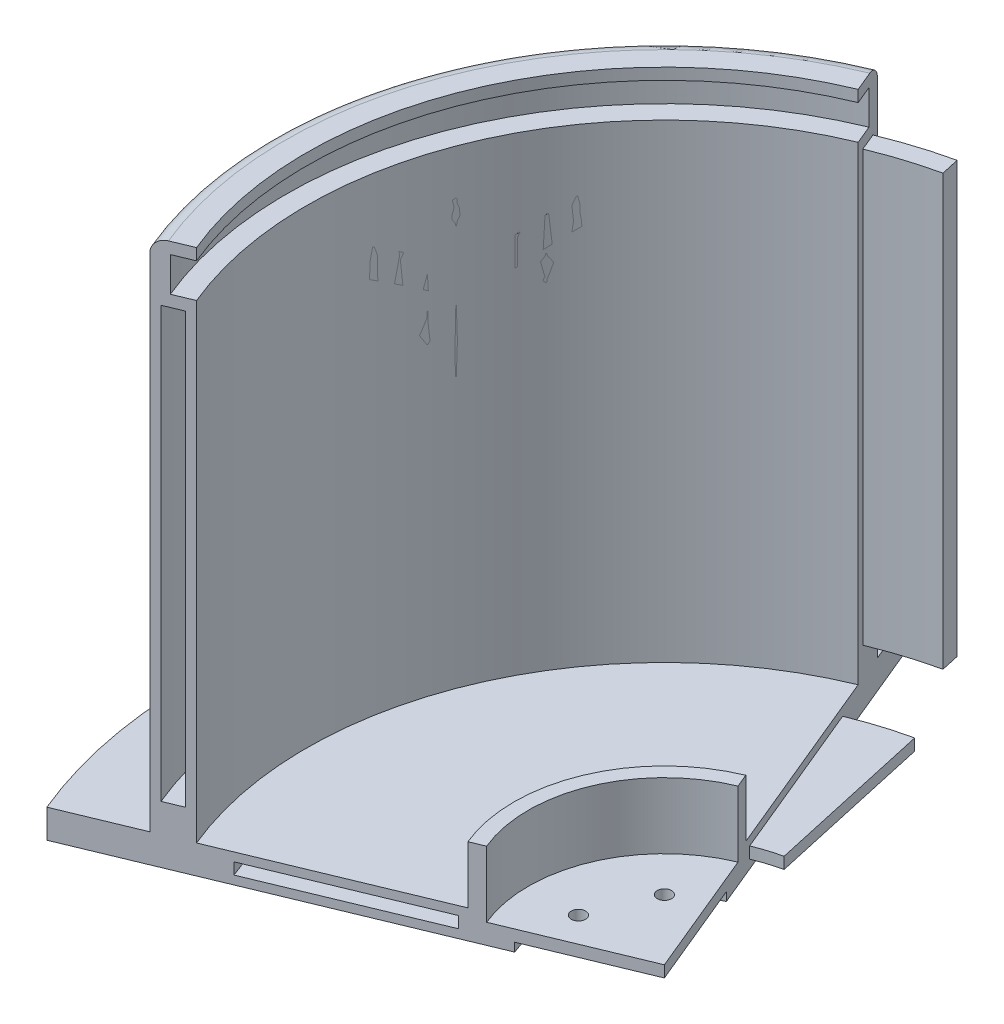
from build123d import *
from OCP.BRepAlgoAPI import BRepAlgoAPI_Cut
from OCP.TopTools import TopTools_ListOfShape

# Parameters (mm, degrees)
SKETCH1_R                 = 137.5
SKETCH1_R_2               = 125
BOSS_EXTRUDE1_DEPTH       = 180
SKETCH2_R                 = 165
SKETCH2_R_2               = 2.5
BOSS_EXTRUDE2_DEPTH       = 10
SKETCH3_R                 = 52.5
SKETCH3_R_2               = 47.5
BOSS_EXTRUDE3_DEPTH       = 20
SKETCH4_W                 = 56
SKETCH4_H                 = 96
CUT_EXTRUDE4_DEPTH        = 150
SKETCH5_W                 = 56
SKETCH5_H                 = 10
BOSS_EXTRUDE4_DEPTH       = 56
SKETCH6_W                 = 56
SKETCH6_H                 = 56
BOSS_EXTRUDE5_DEPTH       = 10
SKETCH7_R                 = 2.5
SKETCH7_R_2               = 12.5
CUT_EXTRUDE5_DEPTH        = 10
SKETCH8_W                 = 56
SKETCH8_H                 = 86
BOSS_EXTRUDE6_DEPTH       = 5
FILLET1_R                 = 10
FILLET2_R                 = 5
SKETCH9_W                 = 31.730677801
SKETCH9_H                 = 6
CUT_EXTRUDE6_DEPTH        = 10
FILLET3_R                 = 5
CUT_EXTRUDE7_START        = -3
SKETCH10_R                = 47.5
CUT_EXTRUDE7_DEPTH        = 3
SKETCH11_R                = 5
CUT_EXTRUDE8_DEPTH        = 5
SKETCH13_W                = 14
SKETCH13_H                = 12
CUT_EXTRUDE9_DEPTH        = 301.915270467
SKETCH15_W                = 6.5
SKETCH15_H                = 150
SKETCH15_W_2              = 60
SKETCH15_H_2              = 4
REVOLVE1_ANGLE            = 10
SKETCH16_W                = 6.5
SKETCH16_H                = 150
SKETCH16_W_2              = 60
SKETCH16_H_2              = 4
CUT_REVOLVE2_ANGLE        = 10
SKETCH17_R                = 40
CUT_EXTRUDE10_DEPTH       = 3
SKETCH19_W                = 6.25044146
SKETCH19_H                = 4.086827108
BOSS_EXTRUDE7_DEPTH       = 55
BOSS_EXTRUDE32_START      = -55
BOSS_EXTRUDE32_DEPTH      = 55
BOSS_EXTRUDE35_START      = -52
BOSS_EXTRUDE35_DEPTH      = 52
BOSS_EXTRUDE36_START      = -50
BOSS_EXTRUDE36_DEPTH      = 50
BOSS_EXTRUDE36_2_DEPTH    = 50
BOSS_EXTRUDE36_3_DEPTH    = 50
BOSS_EXTRUDE36_4_DEPTH    = 50
BOSS_EXTRUDE36_5_DEPTH    = 50
BOSS_EXTRUDE36_6_DEPTH    = 50
CUT_EXTRUDE12_START       = -180
SKETCH20_R                = 125
SKETCH20_R_2              = 52.5
CUT_EXTRUDE12_DEPTH       = 180
CUT_EXTRUDE13_START       = -40.721630556
CUT_EXTRUDE13_OUTLINE_R   = 52.5
CUT_EXTRUDE13_DEPTH       = 11.721630556
CUT_EXTRUDE13_START_2     = -59
CUT_EXTRUDE13_2_OUTLINE_R = 52.5
CUT_EXTRUDE13_2_DEPTH     = 22
CUT_EXTRUDE13_START_3     = -58
CUT_EXTRUDE13_3_OUTLINE_R = 52.5
CUT_EXTRUDE13_3_DEPTH     = 22
CUT_EXTRUDE14_START       = -113
SKETCH20_4_R              = 125
SKETCH20_4_R_2            = 52.5
CUT_EXTRUDE14_DEPTH       = 113


with BuildPart() as part:
    # Sketch1 → Boss-Extrude1 (new body)
    with BuildSketch(Plane(origin=(0, 0, 0), x_dir=(1, 0, 0), z_dir=(0, 1, 0))):
        with Locations(Location((0, 0, 0), (0, 0, 90))):
            Circle(SKETCH1_R)
        with Locations(Location((0, 0, 0), (0, 0, 90))):
            Circle(SKETCH1_R_2, mode=Mode.SUBTRACT)
    extrude(amount=BOSS_EXTRUDE1_DEPTH)

    # Sketch2 → Boss-Extrude2 (add)
    with BuildSketch(Plane.XZ):
        with Locations(Location((0, 0, 0), (0, 0, 270))):
            Circle(SKETCH2_R)
        with Locations(Location((0, 150, 0), (0, 0, 270))):
            Circle(SKETCH2_R_2, mode=Mode.SUBTRACT)
        with Locations(Location((0, 30, 0), (0, 0, 270))):
            Circle(SKETCH2_R_2, mode=Mode.SUBTRACT)
        with Locations(Location((106.066017178, 106.066017178, 0), (0, 0, 270))):
            Circle(SKETCH2_R_2, mode=Mode.SUBTRACT)
        with Locations(Location((150, 0, 0), (0, 0, 270))):
            Circle(SKETCH2_R_2, mode=Mode.SUBTRACT)
        with Locations(Location((106.066017178, -106.066017178, 0), (0, 0, 270))):
            Circle(SKETCH2_R_2, mode=Mode.SUBTRACT)
        with Locations(Location((0, -150, 0), (0, 0, 270))):
            Circle(SKETCH2_R_2, mode=Mode.SUBTRACT)
        with Locations(Location((-106.066017178, -106.066017178, 0), (0, 0, 270))):
            Circle(SKETCH2_R_2, mode=Mode.SUBTRACT)
        with Locations(Location((-150, 0, 0), (0, 0, 270))):
            Circle(SKETCH2_R_2, mode=Mode.SUBTRACT)
        with Locations(Location((-106.066017178, 106.066017178, 0), (0, 0, 270))):
            Circle(SKETCH2_R_2, mode=Mode.SUBTRACT)
        with Locations(Location((21.213203436, 21.213203436, 0), (0, 0, 270))):
            Circle(SKETCH2_R_2, mode=Mode.SUBTRACT)
        with Locations(Location((30, 0, 0), (0, 0, 270))):
            Circle(SKETCH2_R_2, mode=Mode.SUBTRACT)
        with Locations(Location((21.213203436, -21.213203436, 0), (0, 0, 270))):
            Circle(SKETCH2_R_2, mode=Mode.SUBTRACT)
        with Locations(Location((0, -30, 0), (0, 0, 270))):
            Circle(SKETCH2_R_2, mode=Mode.SUBTRACT)
        with Locations(Location((-21.213203436, -21.213203436, 0), (0, 0, 270))):
            Circle(SKETCH2_R_2, mode=Mode.SUBTRACT)
        with Locations(Location((-30, 0, 0), (0, 0, 270))):
            Circle(SKETCH2_R_2, mode=Mode.SUBTRACT)
        with Locations(Location((-21.213203436, 21.213203436, 0), (0, 0, 270))):
            Circle(SKETCH2_R_2, mode=Mode.SUBTRACT)
    extrude(amount=BOSS_EXTRUDE2_DEPTH)

    # Sketch3 → Boss-Extrude3 (add)
    with BuildSketch(Plane(origin=(0, 0, 0), x_dir=(1, 0, 0), z_dir=(0, 1, 0))):
        with Locations(Location((0, 0, 0), (0, 0, 90))):
            Circle(SKETCH3_R)
        with Locations(Location((0, 0, 0), (0, 0, 270))):
            Circle(SKETCH3_R_2, mode=Mode.SUBTRACT)
    extrude(amount=BOSS_EXTRUDE3_DEPTH)

    # Sketch4 → Cut-Extrude4 (cut)
    with BuildSketch(Plane(origin=(0, 0, 0), x_dir=(0, 0, -1), z_dir=(1, 0, 0))):
        with Locations((0, 112)):
            Rectangle(SKETCH4_W, SKETCH4_H)
    extrude(amount=CUT_EXTRUDE4_DEPTH, mode=Mode.SUBTRACT)

    # Sketch5 → Boss-Extrude4 (add)
    with BuildSketch(Plane(origin=(0, 0, 28), x_dir=(-1, 0, 0), z_dir=(0, 0, -1))):
        with Locations((-121.823643025, 135)):
            Rectangle(SKETCH5_W, SKETCH5_H)
    extrude(amount=BOSS_EXTRUDE4_DEPTH)

    # Sketch6 → Boss-Extrude5 (add)
    with BuildSketch(Plane(origin=(0, 64, 0), x_dir=(1, 0, 0), z_dir=(0, 1, 0))):
        with Locations((121.823643025, 0)):
            Rectangle(SKETCH6_W, SKETCH6_H)
    extrude(amount=-BOSS_EXTRUDE5_DEPTH)

    # Sketch7 → Cut-Extrude5 (cut)
    with BuildSketch(Plane(origin=(0, 140, 0), x_dir=(1, 0, 0), z_dir=(0, 1, 0))):
        with Locations(Location((98.273643025, 23.55, 0), (0, 0, 270))):
            Circle(SKETCH7_R)
        with Locations(Location((145.373643025, 23.55, 0), (0, 0, 270))):
            Circle(SKETCH7_R)
        with Locations(Location((98.273643025, -23.55, 0), (0, 0, 270))):
            Circle(SKETCH7_R)
        with Locations(Location((145.373643025, -23.55, 0), (0, 0, 270))):
            Circle(SKETCH7_R)
        with Locations(Location((121.823643025, 0, 0), (0, 0, 270))):
            Circle(SKETCH7_R_2)
    extrude(amount=-CUT_EXTRUDE5_DEPTH, mode=Mode.SUBTRACT)

    # Sketch8 → Boss-Extrude6 (add)
    with BuildSketch(Plane(origin=(149.823643025, 0, 0), x_dir=(0, 0, -1), z_dir=(1, 0, 0))):
        with Locations((0, 97)):
            Rectangle(SKETCH8_W, SKETCH8_H)
    extrude(amount=BOSS_EXTRUDE6_DEPTH)

    # Fillet1
    # the kernel refuses this fillet: 10 mm, written as the material it takes off along each edge
    with BuildSketch(Plane(origin=(154.823643025, 165, -28), x_dir=(0, 0, 1), z_dir=(0, -1, 0))) as fillet1_piece_1:
        with BuildLine():
            CenterArc((FILLET1_R, FILLET1_R), FILLET1_R, 180, 90)
            Line((0, FILLET1_R), (0, 0))
            Line((0, 0), (FILLET1_R, 0))
        make_face()
    extrude(amount=136, mode=Mode.SUBTRACT)
    with BuildSketch(Plane(origin=(154.823643025, 29, 28), x_dir=(-1, 0, 0), z_dir=(0, 1, 0))) as fillet1_piece_2:
        with BuildLine():
            CenterArc((FILLET1_R, -FILLET1_R), FILLET1_R, 90, 90)
            Line((0, -FILLET1_R), (0, 0))
            Line((0, 0), (FILLET1_R, 0))
        make_face()
    extrude(amount=136, mode=Mode.SUBTRACT)

    # Fillet2
    fillet2_edges = [part.edges().sort_by_distance(p)[0] for p in [
        (93.823643025, 59, 28),
        (93.823643025, 59, -28),
        (93.823643025, 135, -28),
        (93.823643025, 135, 28),
    ]]
    fillet(fillet2_edges, radius=FILLET2_R)

    # Sketch9 → Cut-Extrude6 (cut)
    with BuildSketch(Plane(origin=(0, 140, 0), x_dir=(1, 0, 0), z_dir=(0, 1, 0))):
        with Locations((93.823643026, 0)):
            Rectangle(SKETCH9_W, SKETCH9_H)
    extrude(amount=-CUT_EXTRUDE6_DEPTH, mode=Mode.SUBTRACT)

    # Fillet3
    fillet3_edges = [part.edges().sort_by_distance(p)[0] for p in [
        (0, 180, 137.5),
    ]]
    fillet(fillet3_edges, radius=FILLET3_R)

    # Sketch10 → Cut-Extrude7 (cut)
    with BuildSketch(Plane(origin=(0, 0, 0), x_dir=(1, 0, 0), z_dir=(0, 1, 0)).offset(CUT_EXTRUDE7_START)):
        with Locations(Location((0, 0, 0), (0, 0, 270))):
            Circle(SKETCH10_R)
    extrude(amount=CUT_EXTRUDE7_DEPTH, mode=Mode.SUBTRACT)

    # Sketch11 → Cut-Extrude8 (cut)
    with BuildSketch(Plane(origin=(0, 0, 0), x_dir=(1, 0, 0), z_dir=(0, 1, 0))):
        with Locations(Location((0, 150, 0), (0, 0, 270))):
            Circle(SKETCH11_R)
        with Locations(Location((106.066017178, 106.066017178, 0), (0, 0, 270))):
            Circle(SKETCH11_R)
        with Locations(Location((150, 0, 0), (0, 0, 270))):
            Circle(SKETCH11_R)
        with Locations(Location((106.066017178, -106.066017178, 0), (0, 0, 270))):
            Circle(SKETCH11_R)
        with Locations(Location((0, -150, 0), (0, 0, 270))):
            Circle(SKETCH11_R)
        with Locations(Location((-106.066017178, -106.066017178, 0), (0, 0, 270))):
            Circle(SKETCH11_R)
        with Locations(Location((-150, 0, 0), (0, 0, 270))):
            Circle(SKETCH11_R)
        with Locations(Location((-106.066017178, 106.066017178, 0), (0, 0, 270))):
            Circle(SKETCH11_R)
    extrude(amount=-CUT_EXTRUDE8_DEPTH, mode=Mode.SUBTRACT)

    # Sketch13 → Cut-Revolve1 (revolve, cut)
    with BuildSketch(Plane.XY, mode=Mode.PRIVATE) as cut_revolve1_sk:
        with Locations((-125, 170)):
            Rectangle(SKETCH13_W, SKETCH13_H)
    revolve(cut_revolve1_sk.sketch.rotate(Axis((0, 0, 0), (0, 1, 0)), 90), axis=Axis((0, 0, 0), (0, 1, 0)), mode=Mode.SUBTRACT)

    # Sketch14 → Cut-Extrude9 (cut, through all)
    with BuildSketch(Plane(origin=(0, 180, 0), x_dir=(1, 0, 0), z_dir=(0, 1, 0))):
        with BuildLine():
            Line((-47.835429046, 115.484941564), (0, 0))
            Line((0, 0), (115.484941564, 47.835429046))
            ThreePointArc((115.484941564, 47.835429046), (47.835429046, 115.484941564), (-47.835429046, 115.484941564))
        make_face()
        with BuildLine():
            ThreePointArc((-47.835429046, 115.484941564), (47.835429046, 115.484941564), (115.484941564, 47.835429046))
            Line((115.484941564, 47.835429046), (122.414038058, 50.705554788))
            ThreePointArc((122.414038058, 50.705554788), (50.705554788, 122.414038058), (-50.705554788, 122.414038058))
            Line((-50.705554788, 122.414038058), (-47.835429046, 115.484941564))
        make_face()
        with BuildLine():
            ThreePointArc((-50.705554788, 122.414038058), (50.705554788, 122.414038058), (122.414038058, 50.705554788))
            Line((122.414038058, 50.705554788), (152.440122864, 63.14276634))
            ThreePointArc((152.440122864, 63.14276634), (63.14276634, 152.440122864), (-63.14276634, 152.440122864))
            Line((-63.14276634, 152.440122864), (-50.705554788, 122.414038058))
        make_face()
        with BuildLine():
            Line((152.440122864, 63.14276634), (122.414038058, 50.705554788))
            ThreePointArc((122.414038058, 50.705554788), (129.954049653, 25.849467667), (132.5, 0))
            Line((132.5, 0), (165, 0))
            ThreePointArc((165, 0), (161.829571267, 32.189903133), (152.440122864, 63.14276634))
        make_face()
        with BuildLine():
            Line((115.484941564, 47.835429046), (0, 0))
            Line((0, 0), (125, 0))
            ThreePointArc((125, 0), (122.59816005, 24.386290252), (115.484941564, 47.835429046))
        make_face()
        with BuildLine():
            Line((122.414038058, 50.705554788), (115.484941564, 47.835429046))
            ThreePointArc((115.484941564, 47.835429046), (122.59816005, 24.386290252), (125, 0))
            Line((125, 0), (132.5, 0))
            ThreePointArc((132.5, 0), (129.954049653, 25.849467667), (122.414038058, 50.705554788))
        make_face()
        with BuildLine():
            ThreePointArc((132.5, 0), (110.16972363, -73.613055875), (50.705554788, -122.414038058))
            Line((50.705554788, -122.414038058), (63.14276634, -152.440122864))
            ThreePointArc((63.14276634, -152.440122864), (137.19248603, -91.669088448), (165, 0))
            Line((165, 0), (132.5, 0))
        make_face()
        with BuildLine():
            ThreePointArc((125, 0), (103.933701538, -69.446279127), (47.835429046, -115.484941564))
            Line((47.835429046, -115.484941564), (50.705554788, -122.414038058))
            ThreePointArc((50.705554788, -122.414038058), (110.16972363, -73.613055875), (132.5, 0))
            Line((132.5, 0), (125, 0))
        make_face()
        with BuildLine():
            Line((125, 0), (0, 0))
            Line((0, 0), (47.835429046, -115.484941564))
            ThreePointArc((47.835429046, -115.484941564), (103.933701538, -69.446279127), (125, 0))
        make_face()
        with BuildLine():
            ThreePointArc((50.705554788, -122.414038058), (-50.705554788, -122.414038058), (-122.414038058, -50.705554788))
            Line((-122.414038058, -50.705554788), (-152.440122864, -63.14276634))
            ThreePointArc((-152.440122864, -63.14276634), (-63.14276634, -152.440122864), (63.14276634, -152.440122864))
            Line((63.14276634, -152.440122864), (50.705554788, -122.414038058))
        make_face()
        with BuildLine():
            ThreePointArc((47.835429046, -115.484941564), (-47.835429046, -115.484941564), (-115.484941564, -47.835429046))
            Line((-115.484941564, -47.835429046), (-122.414038058, -50.705554788))
            ThreePointArc((-122.414038058, -50.705554788), (-50.705554788, -122.414038058), (50.705554788, -122.414038058))
            Line((50.705554788, -122.414038058), (47.835429046, -115.484941564))
        make_face()
        with BuildLine():
            Line((47.835429046, -115.484941564), (0, 0))
            Line((0, 0), (-115.484941564, -47.835429046))
            ThreePointArc((-115.484941564, -47.835429046), (-47.835429046, -115.484941564), (47.835429046, -115.484941564))
        make_face()
    extrude(amount=-CUT_EXTRUDE9_DEPTH, mode=Mode.SUBTRACT)

    # Sketch15 → Revolve1 (revolve)
    with BuildSketch(Plane(origin=(0, 0, 0), x_dir=(-0.38268343236509034, 0, -0.9238795325112865), z_dir=(0.9238795325112865, 0, -0.38268343236509034))):
        with Locations((131.25, 85)):
            Rectangle(SKETCH15_W, SKETCH15_H)
        with Locations((85, -5)):
            Rectangle(SKETCH15_W_2, SKETCH15_H_2)
    revolve(axis=Axis((0, 0, 0), (0, -1, 0)), revolution_arc=REVOLVE1_ANGLE)

    # Sketch16 → Cut-Revolve2 (revolve, cut)
    with BuildSketch(Plane(origin=(0, 0, 0), x_dir=(0.9238795325112864, 0, -0.3826834323650908), z_dir=(0.3826834323650908, 0, 0.9238795325112864))):
        with Locations((-131.25, 85)):
            Rectangle(SKETCH16_W, SKETCH16_H)
        with Locations((-85, -5)):
            Rectangle(SKETCH16_W_2, SKETCH16_H_2)
    revolve(axis=Axis((0, 0, 0), (0, -1, 0)), revolution_arc=CUT_REVOLVE2_ANGLE, mode=Mode.SUBTRACT)

    # Sketch17 → Cut-Extrude10 (cut)
    with BuildSketch(Plane.XZ.offset(10)):
        Circle(SKETCH17_R)
    extrude(amount=-CUT_EXTRUDE10_DEPTH, mode=Mode.SUBTRACT)

    # Sketch19 → Boss-Extrude7 (add)
    # profile 1 of 9: a face of its own
    with BuildSketch(Plane(origin=(-81.660185305, 0, -33.824756259), x_dir=(0.3826834323650891, 0, -0.9238795325112871), z_dir=(0.9238795325112872, 0, 0.38268343236508917))):
        Polygon((62.618709378, 50), (62.618709378, 52.884819135), (58.772283864, 52.884819135), (58.772283864, 64.664497271), (62.618709378, 64.664497271), (62.618709378, 60.577670163), (67.186339675, 60.577670163), (67.186339675, 67.549316406), (43.626983404, 67.549316406), (43.626983404, 60.577670163), (48.194613701, 60.577670163), (48.194613701, 64.664497271), (52.041039215, 64.664497271), (52.041039215, 52.884819135), (48.194613701, 52.884819135), (48.194613701, 50), align=None)
    # profile 2 of 9: a face of its own
    with BuildSketch(Plane(origin=(-81.660185305, 0, -33.824756259), x_dir=(0.3826834323650891, 0, -0.9238795325112871), z_dir=(0.9238795325112872, 0, 0.38268343236508917))):
        Polygon((35.501409506, 50), (35.501409506, 52.884819135), (32.135787182, 52.884819135), (32.135787182, 64.664497271), (35.501409506, 64.664497271), (35.501409506, 67.549316406), (12.182454829, 67.549316406), (12.182454829, 62.260481325), (17.230888316, 62.260481325), (17.230888316, 64.664497271), (25.404542533, 64.664497271), (25.404542533, 60.577670163), (18.913699478, 60.577670163), (18.913699478, 57.692851027), (25.404542533, 57.692851027), (25.404542533, 52.884819135), (17.230888316, 52.884819135), (17.230888316, 55.288835081), (12.182454829, 55.288835081), (12.182454829, 50), align=None)
    # profile 3 of 9: a face of its own
    with BuildSketch(Plane(origin=(-81.660185305, 0, -33.824756259), x_dir=(0.3826834323650891, 0, -0.9238795325112871), z_dir=(0.9238795325112872, 0, 0.38268343236508917))):
        Polygon((-22.14689288, 52.884819135), (-22.14689288, 50), (-9.165206772, 50), (-9.165206772, 52.884819135), (-12.549610471, 52.884819135), (-11.295014649, 56.010039865), (-4.424787828, 56.010039865), (-3.016184735, 52.884819135), (-6.520789231, 52.884819135), (-6.520789231, 50), (5.258888905, 50), (5.258888905, 52.884819135), (1.89326658, 52.884819135), (-3.264098879, 64.664497271), (0.210455418, 64.664497271), (0.210455418, 67.549316406), (-17.098459394, 67.549316406), (-17.098459394, 64.664497271), (-13.46614155, 64.664497271), (-19.02167215, 52.884819135), align=None)
        Polygon((-10.198182373, 58.654457406), (-8.004517823, 63.916998563), (-5.645577176, 58.654457406), align=None, mode=Mode.SUBTRACT)
    # profile 4 of 9: a face of its own
    with BuildSketch(Plane(origin=(-81.660185305, 0, -33.824756259), x_dir=(0.3826834323650891, 0, -0.9238795325112871), z_dir=(0.9238795325112872, 0, 0.38268343236508917))):
        Polygon((-28.83005721, 50), (-28.83005721, 52.884819135), (-32.195679535, 52.884819135), (-32.195679535, 64.664497271), (-28.83005721, 64.664497271), (-28.83005721, 67.549316406), (-42.033363539, 67.549316406), (-47.664019638, 57.396105309), (-53.227062788, 67.549316406), (-66.813509158, 67.549316406), (-66.813509158, 64.664497271), (-63.447886834, 64.664497271), (-63.447886834, 52.884819135), (-66.813509158, 52.884819135), (-66.813509158, 50), (-53.591421455, 50), (-53.591421455, 52.884819135), (-56.716642185, 52.884819135), (-56.716642185, 64.664497271), (-56.100613099, 64.664497271), (-48.065941054, 50), (-45.267516242, 50), (-37.138937324, 64.664497271), (-36.522908238, 64.664497271), (-36.522908238, 52.884819135), (-39.888530562, 52.884819135), (-39.888530562, 50), align=None)
    # profile 5 of 9: a face of its own
    with BuildSketch(Plane(origin=(-81.660185305, 0, -33.824756259), x_dir=(0.3826834323650891, 0, -0.9238795325112871), z_dir=(0.9238795325112872, 0, 0.38268343236508917))):
        with BuildLine():
            Line((40.020959485, 20.392210242), (40.020959485, 17.507391107))
            Line((40.020959485, 17.507391107), (48.066900354, 17.507391107))
            Line((48.066900354, 17.507391107), (54.144553168, 25.200242134))
            Line((54.144553168, 25.200242134), (57.089472702, 25.200242134))
            Line((57.089472702, 25.200242134), (57.089472702, 20.392210242))
            Line((57.089472702, 20.392210242), (53.723850377, 20.392210242))
            Line((53.723850377, 20.392210242), (53.723850377, 17.507391107))
            Line((53.723850377, 17.507391107), (67.42674127, 17.507391107))
            Line((67.42674127, 17.507391107), (67.42674127, 20.392210242))
            Line((67.42674127, 20.392210242), (63.820717351, 20.392210242))
            Line((63.820717351, 20.392210242), (63.820717351, 32.171888378))
            Line((63.820717351, 32.171888378), (67.42674127, 32.171888378))
            Line((67.42674127, 32.171888378), (67.42674127, 35.056707513))
            Line((67.42674127, 35.056707513), (51.575261126, 35.056707513))
            add(Edge.make_bspline(
                [(51.575261126, 35.056707513), (51.21451779, 35.053114865), (50.518562345, 35.046183834), (49.514378248, 34.972864272), (48.587963374, 34.860611777), (47.7407578, 34.695655001), (46.969410445, 34.487791419), (46.27689696, 34.230306192), (45.660097726, 33.926366688), (45.1255031, 33.571206345), (44.664310771, 33.184669301), (44.259151916, 32.790593824), (43.914496183, 32.384631732), (43.632124285, 31.964986196), (43.415643324, 31.528850084), (43.26231542, 31.08047818), (43.161914244, 30.619964027), (43.151448728, 30.308040098), (43.146180215, 30.151012473)],
                knots=[0, 0, 0, 0, 1.600467958, 3.087664496, 4.465243776, 5.739016891, 6.914364946, 8.006181148, 9.012487675, 9.958636093, 10.846428019, 11.679342585, 12.463994951, 13.205191978, 13.918307352, 14.617610162, 15.304082272, 16, 16, 16, 16], degree=3))
            add(Edge.make_bspline(
                [(43.146180215, 30.151012473), (43.14988159, 30.028098036), (43.157167761, 29.786140488), (43.212199502, 29.430230037), (43.296475876, 29.086720378), (43.423461434, 28.758025145), (43.581076354, 28.439686557), (43.778742208, 28.135504563), (44.007759256, 27.841701519), (44.273757906, 27.561932954), (44.574373391, 27.295944018), (44.911575266, 27.043125711), (45.28418812, 26.804128493), (45.689801752, 26.57444078), (46.132126702, 26.360446673), (46.609119, 26.159155879), (47.119550269, 25.965946402), (47.475301159, 25.854537638), (47.657466388, 25.797489846)],
                knots=[0, 0, 0, 0, 0.873585475, 1.719656409, 2.555264747, 3.383633297, 4.219715739, 5.076630301, 5.958163372, 6.865001544, 7.817242384, 8.808988941, 9.858471776, 10.962711996, 12.121344946, 13.349930203, 14.643009512, 16, 16, 16, 16], degree=3))
            Line((47.657466388, 25.797489846), (43.386581809, 20.392210242))
            Line((43.386581809, 20.392210242), (40.020959485, 20.392210242))
        make_face()
        with BuildLine():
            Line((57.089472702, 28.085061269), (54.730532055, 28.085061269))
            add(Edge.make_bspline(
                [(54.730532055, 28.085061269), (54.553936171, 28.085909615), (54.211800833, 28.087553193), (53.715954108, 28.117006939), (53.254386515, 28.150988753), (52.826658815, 28.20720391), (52.434897585, 28.283118837), (52.073696179, 28.367450427), (51.748643467, 28.472251406), (51.455479367, 28.591072353), (51.200535505, 28.731470104), (50.974438265, 28.88072576), (50.783969739, 29.051116371), (50.630075658, 29.239838041), (50.506041631, 29.44232229), (50.418177549, 29.662971044), (50.370787973, 29.901102374), (50.36245432, 30.064428301), (50.358228053, 30.147256198)],
                knots=[0, 0, 0, 0, 1.582812427, 3.066527101, 4.451694772, 5.731188275, 6.930949323, 8.028082308, 9.053941831, 9.989892088, 10.858830093, 11.658924531, 12.413974936, 13.139757846, 13.83467985, 14.535019726, 15.257060789, 16, 16, 16, 16], degree=3))
            add(Edge.make_bspline(
                [(50.358228053, 30.147256198), (50.36042809, 30.230217254), (50.364703351, 30.391432751), (50.417760839, 30.623060212), (50.491028294, 30.840960761), (50.601118607, 31.042183668), (50.74720179, 31.22353438), (50.921661825, 31.390041839), (51.126749918, 31.540134487), (51.360189537, 31.676702473), (51.623868713, 31.788018531), (51.906393421, 31.897371772), (52.216586973, 31.980935822), (52.548577698, 32.05312248), (52.905447499, 32.103074011), (53.283440067, 32.146469694), (53.686049067, 32.167470057), (53.961731132, 32.170389748), (54.103234144, 32.171888378)],
                knots=[0, 0, 0, 0, 0.837845841, 1.628158325, 2.393598007, 3.159142566, 3.934896225, 4.741497232, 5.5930293, 6.501488864, 7.471574116, 8.485997326, 9.565149973, 10.71831551, 11.92256371, 13.209941372, 14.567909388, 16, 16, 16, 16], degree=3))
            Line((54.103234144, 32.171888378), (57.089472702, 32.171888378))
            Line((57.089472702, 32.171888378), (57.089472702, 28.085061269))
        make_face(mode=Mode.SUBTRACT)
    # profile 6 of 9: a face of its own
    with BuildSketch(Plane(origin=(-81.660185305, 0, -33.824756259), x_dir=(0.3826834323650891, 0, -0.9238795325112871), z_dir=(0.9238795325112872, 0, 0.38268343236508917))):
        with Locations((27.808558479, 19.550804661)):
            Rectangle(SKETCH19_W, SKETCH19_H)
    # profile 7 of 9: a face of its own
    with BuildSketch(Plane(origin=(-81.660185305, 0, -33.824756259), x_dir=(0.3826834323650891, 0, -0.9238795325112871), z_dir=(0.9238795325112872, 0, 0.38268343236508917))):
        Polygon((14.153747905, 17.507391107), (14.153747905, 20.392210242), (10.788125581, 20.392210242), (10.788125581, 32.171888378), (14.153747905, 32.171888378), (14.153747905, 35.056707513), (-9.165206772, 35.056707513), (-9.165206772, 29.767872432), (-4.116773285, 29.767872432), (-4.116773285, 32.171888378), (4.056880932, 32.171888378), (4.056880932, 28.085061269), (-2.433962123, 28.085061269), (-2.433962123, 25.200242134), (4.056880932, 25.200242134), (4.056880932, 20.392210242), (-4.116773285, 20.392210242), (-4.116773285, 22.796226188), (-9.165206772, 22.796226188), (-9.165206772, 17.507391107), align=None)
    # profile 8 of 9: a face of its own
    with BuildSketch(Plane(origin=(-81.660185305, 0, -33.824756259), x_dir=(0.3826834323650891, 0, -0.9238795325112871), z_dir=(0.9238795325112872, 0, 0.38268343236508917))):
        with Locations((-23.06041894, 19.550804661)):
            Rectangle(SKETCH19_W, SKETCH19_H)
    # profile 9 of 9: a face of its own
    with BuildSketch(Plane(origin=(-81.660185305, 0, -33.824756259), x_dir=(0.3826834323650891, 0, -0.9238795325112871), z_dir=(0.9238795325112872, 0, 0.38268343236508917))):
        with BuildLine():
            Line((-36.474827919, 17.507391107), (-36.474827919, 20.392210242))
            Line((-36.474827919, 20.392210242), (-40.561655027, 20.392210242))
            Line((-40.561655027, 20.392210242), (-40.561655027, 32.171888378))
            Line((-40.561655027, 32.171888378), (-36.474827919, 32.171888378))
            Line((-36.474827919, 32.171888378), (-36.474827919, 35.056707513))
            Line((-36.474827919, 35.056707513), (-48.994492213, 35.056707513))
            add(Edge.make_bspline(
                [(-48.994492213, 35.056707513), (-49.316283673, 35.056257841), (-49.943627942, 35.055381188), (-50.860274338, 35.040730762), (-51.727919814, 35.012773542), (-52.548465026, 34.982911735), (-53.319345657, 34.929765919), (-54.043845237, 34.882140504), (-54.718387747, 34.811567343), (-55.554383494, 34.71598637), (-56.556221994, 34.539669494), (-57.728337601, 34.235558052), (-58.871605685, 33.826177369), (-59.800221789, 33.412044763), (-60.512880687, 33.026396029), (-61.028169316, 32.721668805), (-61.506585868, 32.378511019), (-61.968305857, 32.025263593), (-62.394470174, 31.640380916), (-62.797645311, 31.235708336), (-63.17026339, 30.805477569), (-63.516787958, 30.355009845), (-63.829101508, 29.886923611), (-64.099601994, 29.401720615), (-64.329398339, 28.904510049), (-64.519421814, 28.396628672), (-64.660569004, 27.874089892), (-64.767943609, 27.341224122), (-64.827495888, 26.792996631), (-64.837273547, 26.42366728), (-64.842216082, 26.236974011)],
                knots=[0, 0, 0, 0, 1.332696504, 2.598140772, 3.796552738, 4.927965653, 5.998313975, 6.996582906, 7.934637337, 8.80681236, 10.481191126, 12.142680594, 13.815613367, 15.505219703, 16.347420755, 17.170927932, 17.982329855, 18.784147397, 19.577384055, 20.358407803, 21.148672732, 21.932771828, 22.710846321, 23.476922527, 24.230970006, 24.977491157, 25.719731627, 26.470258298, 27.226726824, 28, 28, 28, 28], degree=3))
            add(Edge.make_bspline(
                [(-64.842216082, 26.236974011), (-64.838874835, 26.085408791), (-64.832207878, 25.782983167), (-64.792459896, 25.331833738), (-64.714101656, 24.887298941), (-64.61507811, 24.44727704), (-64.48066234, 24.014374244), (-64.32472621, 23.583571759), (-64.13155267, 23.16102588), (-63.843011949, 22.609936344), (-63.438794574, 21.957872604), (-62.881685949, 21.249141834), (-62.277456608, 20.611867843), (-61.607296811, 20.059222735), (-60.877323782, 19.575473234), (-60.083222963, 19.146462865), (-59.22243016, 18.768190232), (-58.310187111, 18.448249348), (-57.384137632, 18.187222785), (-56.483569868, 17.960166919), (-55.618784047, 17.797430516), (-54.912441291, 17.693613174), (-54.332482494, 17.640010038), (-53.849239455, 17.601832226), (-53.31068067, 17.572384935), (-52.717044383, 17.551109394), (-52.068439325, 17.532579518), (-51.364772531, 17.516575313), (-50.607195811, 17.510508086), (-50.083811898, 17.50845303), (-49.813360145, 17.507391107)],
                knots=[0, 0, 0, 0, 0.653562848, 1.304086475, 1.95018235, 2.598394733, 3.247326054, 3.903181291, 4.572451889, 5.248545877, 6.584700914, 7.873019034, 9.129176232, 10.363651628, 11.609360228, 12.899294715, 14.250426218, 15.659035459, 17.063490434, 18.39768105, 19.661828393, 20.855862999, 21.474138548, 22.172621017, 22.945798865, 23.799360362, 24.733673004, 25.743404147, 26.833933771, 28, 28, 28, 28], degree=3))
            Line((-49.813360145, 17.507391107), (-36.474827919, 17.507391107))
        make_face()
        with BuildLine():
            Line((-47.292899676, 20.392210242), (-48.953173189, 20.392210242))
            add(Edge.make_bspline(
                [(-48.953173189, 20.392210242), (-49.197360411, 20.393213043), (-49.673366018, 20.39516785), (-50.368445993, 20.423034635), (-51.024835052, 20.463139472), (-51.641143044, 20.519365539), (-52.219121952, 20.589295456), (-52.757701329, 20.679797035), (-53.258766044, 20.78242077), (-53.722068374, 20.909056965), (-54.156661706, 21.049412811), (-54.56552114, 21.22038173), (-54.952226466, 21.416881258), (-55.321628682, 21.63214666), (-55.663843691, 21.87877742), (-55.985668094, 22.146943471), (-56.286677187, 22.440060243), (-56.565239221, 22.759698814), (-56.817078766, 23.104264003), (-57.036662816, 23.474986723), (-57.22106723, 23.871470328), (-57.371312258, 24.294110654), (-57.487457265, 24.741720748), (-57.568140343, 25.214268943), (-57.624206545, 25.711003971), (-57.628150456, 26.051500149), (-57.630168244, 26.225705186)],
                knots=[0, 0, 0, 0, 1.471220557, 2.867919254, 4.190781564, 5.433215145, 6.596362996, 7.69773095, 8.723120877, 9.676605245, 10.59034093, 11.473026839, 12.343505838, 13.202631779, 14.046315256, 14.881864041, 15.724805107, 16.575040716, 17.43366964, 18.292795582, 19.166961063, 20.064196578, 20.99193373, 21.949468653, 22.950904847, 24, 24, 24, 24], degree=3))
            add(Edge.make_bspline(
                [(-57.630168244, 26.225705186), (-57.628205351, 26.39242094), (-57.624357613, 26.719223402), (-57.566741408, 27.199384635), (-57.489080489, 27.661694244), (-57.364528977, 28.103538568), (-57.216995604, 28.528277124), (-57.031919457, 28.933868609), (-56.80827732, 29.31630998), (-56.557320607, 29.681674632), (-56.276482502, 30.021732358), (-55.970255397, 30.336233842), (-55.638792625, 30.621543961), (-55.284470371, 30.881164647), (-54.90798518, 31.116527754), (-54.504064475, 31.317404072), (-54.079523788, 31.495919068), (-53.627020393, 31.640649697), (-53.149431746, 31.76859657), (-52.641587271, 31.87708754), (-52.103568468, 31.965886739), (-51.534809039, 32.040810086), (-50.933638963, 32.101740043), (-50.300813587, 32.140489692), (-49.63707564, 32.169022618), (-49.184843703, 32.170917608), (-48.953173189, 32.171888378)],
                knots=[0, 0, 0, 0, 1.00094045, 1.962080932, 2.902028123, 3.814481939, 4.716205769, 5.60149496, 6.48790204, 7.374723979, 8.261801118, 9.134212688, 10.008891528, 10.886057597, 11.771155007, 12.672753318, 13.593387695, 14.535409596, 15.524406578, 16.563106428, 17.653864101, 18.799676788, 20.009274465, 21.283261448, 22.608262337, 24, 24, 24, 24], degree=3))
            Line((-48.953173189, 32.171888378), (-47.292899676, 32.171888378))
            Line((-47.292899676, 32.171888378), (-47.292899676, 20.392210242))
        make_face(mode=Mode.SUBTRACT)
    extrude(amount=-BOSS_EXTRUDE7_DEPTH)

    # Boss-Extrude32: read off the stored shape, not the designer's step
    # Boss-Extrude32 outline → Boss-Extrude32 (add)
    with BuildSketch(Plane(origin=(-81.660185305, 0, -33.824756259), x_dir=(0.3826834323650891, 0, -0.9238795325112871), z_dir=(0.9238795325112872, 0, 0.38268343236508917)).offset(BOSS_EXTRUDE32_START)):
        with BuildLine():
            ThreePointArc((0, 157.631397208), (-37.565698604, 147.565698604), (-27.5, 110))
            ThreePointArc((-27.5, 110), (-4.116118026, 82.809789034), (26.267823447, 101.860500547))
            Line((26.267823447, 101.860500547), (26.056807624, 102.07151637))
            ThreePointArc((26.056807624, 102.07151637), (-5.13066435, 89.909712799), (-13.894240986, 122.217105123))
            Line((-13.894240986, 122.217105123), (-21.790333493, 126.775916257))
            ThreePointArc((-21.790333493, 126.775916257), (-25.869384718, 119.328715578), (-27.482097315, 110.992132649))
            ThreePointArc((-27.482097315, 110.992132649), (-28.86654623, 145.481232801), (5.324463257, 140.749467978))
            Line((5.324463257, 140.749467978), (11.600814445, 144.473381606))
            ThreePointArc((11.600814445, 144.473381606), (8.047862169, 150.581831278), (3.055555556, 155.58318129))
            ThreePointArc((3.055555556, 155.58318129), (30.930476766, 137.594117641), (10.583720804, 111.390546029))
            Line((10.583720804, 111.390546029), (10.583720804, 106.498585359))
            ThreePointArc((10.583720804, 106.498585359), (40.679189319, 139.389634614), (0, 157.631397208))
        make_face()
        with BuildLine():
            ThreePointArc((24.962733118, 120.379753679), (25.149339372, 120.537706968), (25.333720804, 120.698251736))
            ThreePointArc((25.333720804, 120.698251736), (23.613225928, 124.094877129), (21.440070063, 127.221306445))
            Line((21.440070063, 127.221306445), (20.268661801, 126.526281094))
            ThreePointArc((20.268661801, 126.526281094), (22.881771355, 123.65621665), (24.962733118, 120.379753679))
        make_face()
        with BuildLine():
            ThreePointArc((-11.254013242, 144.11567211), (-9.335086964, 147.201498152), (-6.944444444, 149.938180224))
            ThreePointArc((-6.944444444, 149.938180224), (-7.558706992, 150.18389615), (-8.181818182, 150.406218525))
            ThreePointArc((-8.181818182, 150.406218525), (-10.110952568, 147.487016849), (-11.653790424, 144.346483574))
            Line((-11.653790424, 144.346483574), (-11.254013242, 144.11567211))
        make_face()
        Polygon((-11.218374311, 132.41322491), (-11.218374311, 122.404243585), (-2.5, 127.320508076), (-2.5, 137.329489401), align=None)
        Polygon((11.583720804, 123.117446868), (11.583720804, 133.126428193), (2.5, 137.329489401), (2.5, 127.320508076), align=None)
        Polygon((0.365346493, 113.871055358), (9.083720804, 118.787319849), (0, 122.990381057), (-8.718374311, 118.074116566), align=None)
    extrude(amount=BOSS_EXTRUDE32_DEPTH)

    # Sketch21<9> → Boss-Extrude35 (add)
    with BuildSketch(Plane(origin=(-81.660185305, 0, -33.824756259), x_dir=(0.3826834323650891, 0, -0.9238795325112871), z_dir=(0.9238795325112872, 0, 0.38268343236508917)).offset(BOSS_EXTRUDE35_START)):
        with BuildLine():
            Line((-11.218374311, 132.41322491), (-2.5, 137.329489401))
            Line((-2.5, 137.329489401), (-21.319588017, 148.194983609))
            ThreePointArc((-21.319588017, 148.194983609), (-24.995556418, 145.545999574), (-27.797225364, 141.985029029))
            Line((-27.797225364, 141.985029029), (-13.749929391, 133.874818917))
            Line((-13.749929391, 133.874818917), (-13.698701286, 133.845242357))
            Line((-13.698701286, 133.845242357), (-11.218374311, 132.41322491))
        make_face()
        with BuildLine():
            Line((2.5, 137.329489401), (11.583720804, 133.126428193))
            Line((11.583720804, 133.126428193), (27.456730087, 142.544275253))
            ThreePointArc((27.456730087, 142.544275253), (24.644214174, 145.873003342), (21.048215197, 148.33460197))
            Line((21.048215197, 148.33460197), (2.5, 137.329489401))
        make_face()
        with BuildLine():
            Line((9.083720804, 96.526005924), (9.083720804, 118.787319849))
            Line((9.083720804, 118.787319849), (0.365346493, 113.871055358))
            Line((0.365346493, 113.871055358), (0.365346493, 93.754107536))
            ThreePointArc((0.365346493, 93.754107536), (4.923624007, 94.513863405), (9.083720804, 96.526005924))
        make_face()
        with BuildLine():
            Line((-15.924700518, 151.180049374), (-15.924700518, 151.21035595))
            ThreePointArc((-15.924700518, 151.21035595), (-35.374821981, 135.029962382), (-27.482097315, 110.992132649))
            ThreePointArc((-27.482097315, 110.992132649), (-26.850136831, 115.943075986), (-25.333720804, 120.698251736))
            ThreePointArc((-25.333720804, 120.698251736), (-30.471499219, 138.977235572), (-15.924700518, 151.180049374))
        make_face()
        with BuildLine():
            ThreePointArc((26.056807624, 102.07151637), (27.136261784, 105.97061863), (27.5, 110))
            ThreePointArc((27.5, 110), (22.5, 107.744881586), (17.151902622, 106.526926947))
            ThreePointArc((17.151902622, 106.526926947), (0, 92.5), (-17.151902622, 106.526926947))
            ThreePointArc((-17.151902622, 106.526926947), (-17.191909411, 106.531944104), (-17.231908801, 106.537019913))
            ThreePointArc((-17.231908801, 106.537019913), (2.691234926, 87.618766704), (26.056807624, 102.07151637))
        make_face()
        with BuildLine():
            Line((-13.008626286, 121.705795238), (-13.894240986, 122.217105123))
            ThreePointArc((-13.894240986, 122.217105123), (-15.410234012, 119.469548435), (-16.529218149, 116.537795187))
            ThreePointArc((-16.529218149, 116.537795187), (-16.389695031, 116.515929526), (-16.25, 116.495190528))
            ThreePointArc((-16.25, 116.495190528), (-14.859488665, 119.243678737), (-13.008626286, 121.705795238))
        make_face()
        with BuildLine():
            ThreePointArc((-16.25, 116.495190528), (-16.389695031, 116.515929526), (-16.529218149, 116.537795187))
            ThreePointArc((-16.529218149, 116.537795187), (-17.255981303, 113.304738452), (-17.5, 110.000000124))
            ThreePointArc((-17.5, 110.000000124), (-17.184658844, 113.3071892), (-16.25, 116.495190528))
        make_face()
        with BuildLine():
            Line((2.870575169, 139.293515783), (5.324463257, 140.749467978))
            ThreePointArc((5.324463257, 140.749467978), (-2.333469023, 148.204169933), (-12.567117456, 151.284583509))
            Line((-12.567117456, 151.284583509), (-12.567117456, 151.275675376))
            ThreePointArc((-12.567117456, 151.275675376), (-10.346589018, 150.98155989), (-8.181818182, 150.406218525))
            ThreePointArc((-8.181818182, 150.406218525), (-7.558706992, 150.18389615), (-6.944444444, 149.938180224))
            ThreePointArc((-6.944444444, 149.938180224), (-3.136437787, 147.729802857), (0, 144.641016151))
            ThreePointArc((0, 144.641016151), (1.668881252, 142.092660663), (2.870575169, 139.293515783))
        make_face()
        with BuildLine():
            ThreePointArc((10.583720804, 111.390546029), (24.09595311, 117.361163571), (30.993020316, 130.424821545))
            Line((30.993020316, 130.424821545), (30.921127861, 130.438959351))
            ThreePointArc((30.921127861, 130.438959351), (28.929943236, 125.1082694), (25.333720804, 120.698251736))
            ThreePointArc((25.333720804, 120.698251736), (25.149339372, 120.537706968), (24.962733118, 120.379753679))
            ThreePointArc((24.962733118, 120.379753679), (20.876164474, 117.832339136), (16.25, 116.495190528))
            ThreePointArc((16.25, 116.495190528), (13.412405252, 116.318955199), (10.583720804, 116.604519793))
            Line((10.583720804, 116.604519793), (10.583720804, 111.390546029))
        make_face()
        with BuildLine():
            ThreePointArc((3.055555556, 155.58318129), (5.790887055, 153.165213666), (8.181818182, 150.406218525))
            ThreePointArc((8.181818182, 150.406218525), (22.16052229, 149.162135155), (30.730349841, 138.048631309))
            Line((30.730349841, 138.048631309), (30.848241575, 138.048631309))
            ThreePointArc((30.848241575, 138.048631309), (20.755675776, 152.844985221), (3.055555556, 155.58318129))
        make_face()
    extrude(amount=BOSS_EXTRUDE35_DEPTH)

    # Sketch20 → Cut-Extrude12 (cut)
    with BuildSketch(Plane(origin=(0, 180, 0), x_dir=(1, 0, 0), z_dir=(0, 1, 0)).offset(CUT_EXTRUDE12_START)):
        Circle(SKETCH20_R)
        Circle(SKETCH20_R_2, mode=Mode.SUBTRACT)
    extrude(amount=CUT_EXTRUDE12_DEPTH, mode=Mode.SUBTRACT)


with BuildPart() as body_2:
    # Boss-Extrude36: read off the stored shape, not the designer's step
    # Boss-Extrude36 outline → Boss-Extrude36 (new body)
    with BuildSketch(Plane(origin=(-81.660185305, 0, -33.824756259), x_dir=(0.3826834323650891, 0, -0.9238795325112871), z_dir=(0.9238795325112872, 0, 0.38268343236508917)).offset(BOSS_EXTRUDE36_START)):
        with BuildLine():
            Line((0.365346493, 113.871055358), (-8.718374311, 118.074116566))
            Line((-8.718374311, 118.074116566), (-8.718374311, 96.286778301))
            ThreePointArc((-8.718374311, 96.286778301), (-4.364272417, 94.347025003), (0.365346493, 93.754107536))
            Line((0.365346493, 93.754107536), (0.365346493, 113.871055358))
        make_face()
    extrude(amount=BOSS_EXTRUDE36_DEPTH)


with BuildPart() as body_3:
    # Boss-Extrude36 2 outline → Boss-Extrude36 2 (new body)
    with BuildSketch(Plane(origin=(-81.660185305, 0, -33.824756259), x_dir=(0.3826834323650891, 0, -0.9238795325112871), z_dir=(0.9238795325112872, 0, 0.38268343236508917)).offset(BOSS_EXTRUDE36_START)):
        with BuildLine():
            ThreePointArc((-10.218374311, 116.675756364), (-13.226345633, 116.323535041), (-16.25, 116.495190528))
            ThreePointArc((-16.25, 116.495190528), (-17.426540996, 111.601770554), (-17.161740169, 106.575868816))
            ThreePointArc((-17.161740169, 106.575868816), (-13.68933069, 106.315780399), (-10.218374311, 106.594591071))
            Line((-10.218374311, 106.594591071), (-10.218374311, 116.675756364))
        make_face()
    extrude(amount=BOSS_EXTRUDE36_2_DEPTH)


with BuildPart() as body_4:
    # Boss-Extrude36 3 outline → Boss-Extrude36 3 (new body)
    with BuildSketch(Plane(origin=(-81.660185305, 0, -33.824756259), x_dir=(0.3826834323650891, 0, -0.9238795325112871), z_dir=(0.9238795325112872, 0, 0.38268343236508917)).offset(BOSS_EXTRUDE36_START)):
        with BuildLine():
            ThreePointArc((12.702624265, 122.037164815), (14.739131002, 119.434406038), (16.25, 116.495190528))
            ThreePointArc((16.25, 116.495190528), (20.876164474, 117.832339136), (24.962733118, 120.379753679))
            ThreePointArc((24.962733118, 120.379753679), (22.881771355, 123.65621665), (20.268661801, 126.526281094))
            Line((20.268661801, 126.526281094), (12.702624265, 122.037164815))
        make_face()
    extrude(amount=BOSS_EXTRUDE36_3_DEPTH)


with BuildPart() as body_5:
    # Boss-Extrude36 4 outline → Boss-Extrude36 4 (new body)
    with BuildSketch(Plane(origin=(-81.660185305, 0, -33.824756259), x_dir=(0.3826834323650891, 0, -0.9238795325112871), z_dir=(0.9238795325112872, 0, 0.38268343236508917)).offset(BOSS_EXTRUDE36_START)):
        with BuildLine():
            ThreePointArc((-2.875559425, 139.278369544), (-1.672650462, 142.085635287), (0, 144.641016151))
            ThreePointArc((0, 144.641016151), (-3.136437786, 147.729802857), (-6.944444444, 149.938180224))
            ThreePointArc((-6.944444444, 149.938180224), (-9.335086964, 147.201498152), (-11.254013242, 144.11567211))
            Line((-11.254013242, 144.11567211), (-2.875559425, 139.278369544))
        make_face()
    extrude(amount=BOSS_EXTRUDE36_4_DEPTH)


with BuildPart() as body_6:
    # Boss-Extrude36 5 outline → Boss-Extrude36 5 (new body)
    with BuildSketch(Plane(origin=(-81.660185305, 0, -33.824756259), x_dir=(0.3826834323650891, 0, -0.9238795325112871), z_dir=(0.9238795325112872, 0, 0.38268343236508917)).offset(BOSS_EXTRUDE36_START)):
        with BuildLine():
            Line((-11.218374311, 122.404243585), (-11.218374311, 132.41322491))
            Line((-11.218374311, 132.41322491), (-13.698701286, 133.845242357))
            ThreePointArc((-13.698701286, 133.845242357), (-13.724358593, 133.830484284), (-13.75, 133.815698604))
            ThreePointArc((-13.75, 133.815698604), (-13.74998411, 133.845260813), (-13.749936442, 133.874822988))
            Line((-13.749936442, 133.874822988), (-27.797225364, 141.985029029))
            ThreePointArc((-27.797225364, 141.985029029), (-29.511893396, 137.768573075), (-29.989868736, 133.241970945))
            Line((-29.989868736, 133.241970945), (-11.218374311, 122.404243585))
        make_face()
    extrude(amount=BOSS_EXTRUDE36_5_DEPTH)


with BuildPart() as body_7:
    # Boss-Extrude36 6 outline → Boss-Extrude36 6 (new body)
    with BuildSketch(Plane(origin=(-81.660185305, 0, -33.824756259), x_dir=(0.3826834323650891, 0, -0.9238795325112871), z_dir=(0.9238795325112872, 0, 0.38268343236508917)).offset(BOSS_EXTRUDE36_START)):
        with BuildLine():
            Line((11.583720804, 133.126428193), (11.583720804, 123.117446868))
            Line((11.583720804, 123.117446868), (29.998405546, 134.043332532))
            ThreePointArc((29.998405546, 134.043332532), (29.319009104, 138.470637434), (27.456730087, 142.544275253))
            Line((27.456730087, 142.544275253), (11.583720804, 133.126428193))
        make_face()
    extrude(amount=BOSS_EXTRUDE36_6_DEPTH)


with BuildPart() as cut_extrude13_tool:
    # Cut-Extrude13: read off the stored shape, not the designer's step
    # Cut-Extrude13 outline → Cut-Extrude13 (new body)
    with BuildSketch(Plane(origin=(0, 180, 0), x_dir=(1, 0, 0), z_dir=(0, 1, 0)).offset(CUT_EXTRUDE13_START)):
        with BuildLine():
            ThreePointArc((-119.322665872, 37.243810348), (117.523183773, -42.582875383), (-115.484941564, 47.835429046))
            ThreePointArc((-115.484941564, 47.835429046), (-117.523183773, 42.582875384), (-119.322665872, 37.243810348))
        make_face()
        Circle(CUT_EXTRUDE13_OUTLINE_R, mode=Mode.SUBTRACT)
    extrude(amount=CUT_EXTRUDE13_DEPTH)


with BuildPart() as body_5_1:
    add(body_5.part)

    # Cut-Extrude13: cut by cut_extrude13_tool, with a tolerance
    cut_extrude13_stock = TopTools_ListOfShape()
    cut_extrude13_stock.Append(body_5_1.part.wrapped)
    cut_extrude13_tools = TopTools_ListOfShape()
    cut_extrude13_tools.Append(cut_extrude13_tool.part.wrapped)
    cut_extrude13_cut = BRepAlgoAPI_Cut()
    cut_extrude13_cut.SetArguments(cut_extrude13_stock)
    cut_extrude13_cut.SetTools(cut_extrude13_tools)
    cut_extrude13_cut.SetFuzzyValue(0.00001)
    cut_extrude13_cut.Build()
    add(Compound.cast(cut_extrude13_cut.Shape()).solids(), mode=Mode.REPLACE)


with BuildPart() as cut_extrude13_2_tool:
    # Cut-Extrude13 2 outline → Cut-Extrude13 2 (new body)
    with BuildSketch(Plane(origin=(0, 180, 0), x_dir=(1, 0, 0), z_dir=(0, 1, 0)).offset(CUT_EXTRUDE13_START_2)):
        with BuildLine():
            ThreePointArc((-123.590210445, 18.72057377), (121.805028939, -28.080864038), (-119.311999184, 37.277967362))
            ThreePointArc((-119.311999184, 37.277967362), (-121.805028939, 28.080864038), (-123.590210445, 18.72057377))
        make_face()
        Circle(CUT_EXTRUDE13_2_OUTLINE_R, mode=Mode.SUBTRACT)
    extrude(amount=CUT_EXTRUDE13_2_DEPTH)


with BuildPart() as body_6_1:
    add(body_6.part)

    # Cut-Extrude13 2: cut by cut_extrude13_2_tool, with a tolerance
    cut_extrude13_2_stock = TopTools_ListOfShape()
    cut_extrude13_2_stock.Append(body_6_1.part.wrapped)
    cut_extrude13_2_tools = TopTools_ListOfShape()
    cut_extrude13_2_tools.Append(cut_extrude13_2_tool.part.wrapped)
    cut_extrude13_2_cut = BRepAlgoAPI_Cut()
    cut_extrude13_2_cut.SetArguments(cut_extrude13_2_stock)
    cut_extrude13_2_cut.SetTools(cut_extrude13_2_tools)
    cut_extrude13_2_cut.SetFuzzyValue(0.00001)
    cut_extrude13_2_cut.Build()
    add(Compound.cast(cut_extrude13_2_cut.Shape()).solids(), mode=Mode.REPLACE)


with BuildPart() as cut_extrude13_3_tool:
    # Cut-Extrude13 3 outline → Cut-Extrude13 3 (new body)
    with BuildSketch(Plane(origin=(0, 180, 0), x_dir=(1, 0, 0), z_dir=(0, 1, 0)).offset(CUT_EXTRUDE13_START_3)):
        with BuildLine():
            ThreePointArc((-110.555100143, 58.331550917), (105.888499371, -66.427597436), (-100.630121612, 74.152401339))
            ThreePointArc((-100.630121612, 74.152401339), (-105.88849937, 66.427597435), (-110.555100143, 58.331550917))
        make_face()
        Circle(CUT_EXTRUDE13_3_OUTLINE_R, mode=Mode.SUBTRACT)
    extrude(amount=CUT_EXTRUDE13_3_DEPTH)


with BuildPart() as body_7_1:
    add(body_7.part)

    # Cut-Extrude13 3: cut by cut_extrude13_3_tool, with a tolerance
    cut_extrude13_3_stock = TopTools_ListOfShape()
    cut_extrude13_3_stock.Append(body_7_1.part.wrapped)
    cut_extrude13_3_tools = TopTools_ListOfShape()
    cut_extrude13_3_tools.Append(cut_extrude13_3_tool.part.wrapped)
    cut_extrude13_3_cut = BRepAlgoAPI_Cut()
    cut_extrude13_3_cut.SetArguments(cut_extrude13_3_stock)
    cut_extrude13_3_cut.SetTools(cut_extrude13_3_tools)
    cut_extrude13_3_cut.SetFuzzyValue(0.00001)
    cut_extrude13_3_cut.Build()
    add(Compound.cast(cut_extrude13_3_cut.Shape()).solids(), mode=Mode.REPLACE)


with BuildPart() as cut_extrude14_tool:
    # Sketch20<4> → Cut-Extrude14 (new body)
    with BuildSketch(Plane(origin=(0, 180, 0), x_dir=(1, 0, 0), z_dir=(0, 1, 0)).offset(CUT_EXTRUDE14_START)):
        Circle(SKETCH20_4_R)
        Circle(SKETCH20_4_R_2, mode=Mode.SUBTRACT)
    extrude(amount=CUT_EXTRUDE14_DEPTH)


with BuildPart() as body_2_1:
    add(body_2.part)

    # Cut-Extrude14: cut by cut_extrude14_tool
    add(cut_extrude14_tool.part, mode=Mode.SUBTRACT)


with BuildPart() as body_3_1:
    add(body_3.part)

    # Cut-Extrude14: cut by cut_extrude14_tool
    add(cut_extrude14_tool.part, mode=Mode.SUBTRACT)


with BuildPart() as body_4_1:
    add(body_4.part)

    # Cut-Extrude14: cut by cut_extrude14_tool
    add(cut_extrude14_tool.part, mode=Mode.SUBTRACT)


solid = Compound([part.part, body_5_1.part, body_6_1.part, body_7_1.part, body_2_1.part, body_3_1.part, body_4_1.part])
